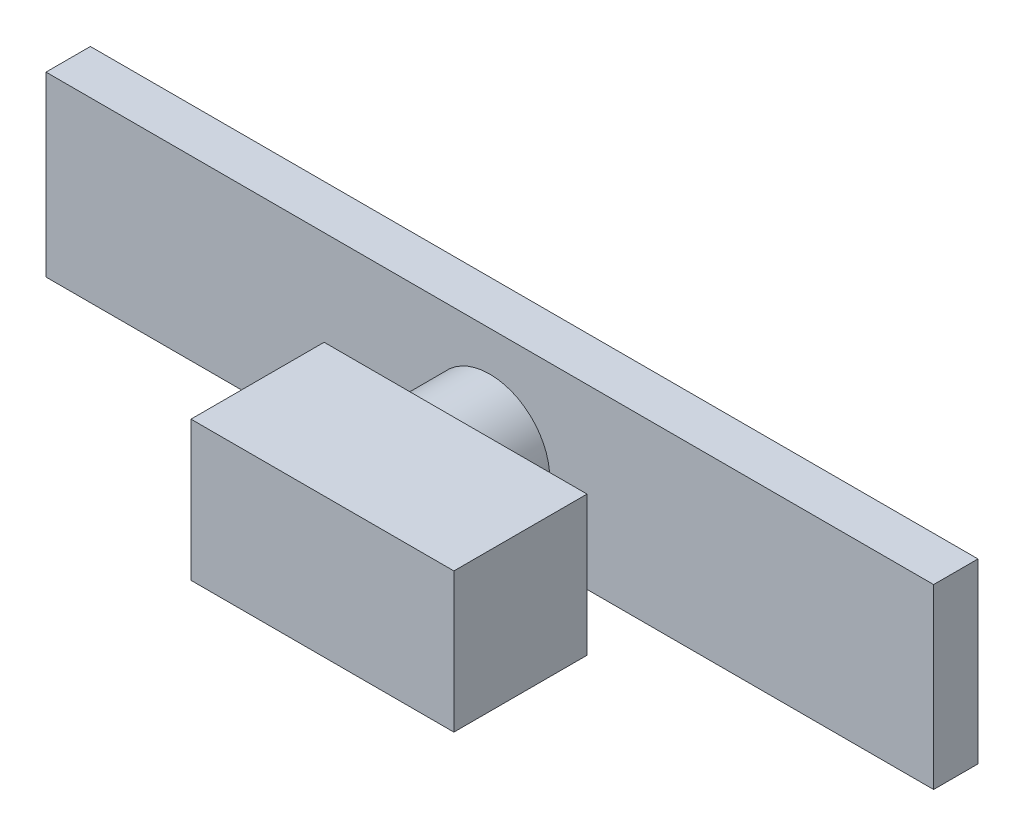
from build123d import *

# Parameters (mm, degrees)
SKETCH2_W           = 254
SKETCH2_H           = 12.7
BOSS_EXTRUDE1_DEPTH = 50.8
SKETCH3_R           = 17.140791438
BOSS_EXTRUDE2_DEPTH = 19.05
SKETCH4_W           = 75.235944222
SKETCH4_H           = 39.955088207
BOSS_EXTRUDE3_DEPTH = 38.1
SCALE2_SCALE        = 0.06
ROTATE_ANGLE        = 90
SCALE5_SCALE        = 0.25
SCALE6_SCALE        = 0.25


with BuildPart() as part:
    # Sketch2 → Boss-Extrude1 (new body)
    with BuildSketch(Plane.XY):
        with Locations((79.130769231, 14.898076923)):
            Rectangle(SKETCH2_W, SKETCH2_H)
    extrude(amount=BOSS_EXTRUDE1_DEPTH)

    # Sketch3 → Boss-Extrude2 (add)
    with BuildSketch(Plane(origin=(0, 21.248076923, 0), x_dir=(1, 0, 0), z_dir=(0, 1, 0))):
        with Locations((79.130769231, -28.483063876)):
            Circle(SKETCH3_R)
    extrude(amount=BOSS_EXTRUDE2_DEPTH)

    # Sketch4 → Boss-Extrude3 (add)
    with BuildSketch(Plane(origin=(0, 40.298076923, 0), x_dir=(1, 0, 0), z_dir=(0, 1, 0))):
        with Locations((88.38546847, -28.088530296)):
            Rectangle(SKETCH4_W, SKETCH4_H)
    extrude(amount=BOSS_EXTRUDE3_DEPTH)


with BuildPart() as part_1:
    # Scale2: scaled about (82.711857342, 33.041003565, 26.623476887)
    add(part.part.scale(SCALE2_SCALE).moved(Location((77.749145901, 31.058543351, 25.026068274))))


with BuildPart() as part_2:
    # rotate: moved
    add(part_1.part.rotate(Axis((0, 33.666927966, 26.550068274), (1, 0, 0)), ROTATE_ANGLE))


with BuildPart() as part_3:
    # Scale5: scaled about (82.711857342, 33.593519353, 25.924143873)
    add(part_2.part.scale(SCALE5_SCALE).moved(Location((62.033893007, 25.195139515, 19.443107905))))


with BuildPart() as part_4:
    # Move Body 4 x: moved
    add(part_3.part.moved(Location((-101.6, 0, 0))))


with BuildPart() as part_5:
    # Move Body 2 y: moved
    add(part_4.part.moved(Location((0, -50.8, 0))))


with BuildPart() as part_6:
    # Scale6: scaled about (-18.888142658, -17.206480647, 25.924143873)
    add(part_5.part.scale(SCALE6_SCALE).moved(Location((-14.166106993, -12.904860485, 19.443107905))))


with BuildPart() as part_7:
    # Move Body 2.1z: moved
    add(part_6.part.moved(Location((0, 0, -25.4))))


solid = part_7.part
